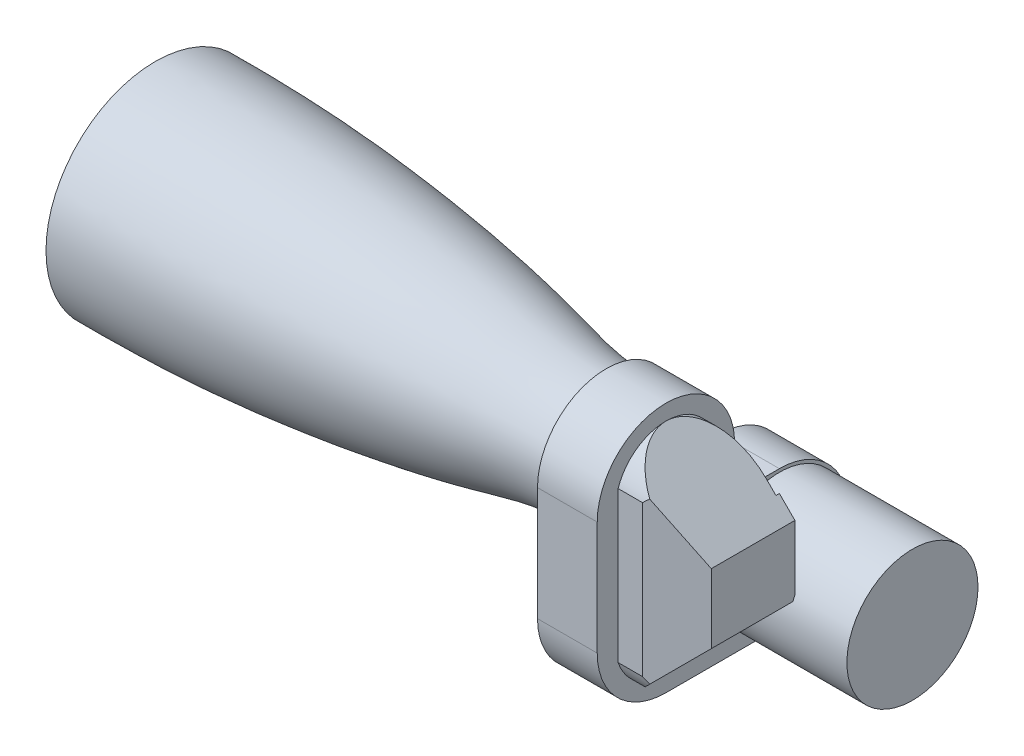
from build123d import *

# Parameters (mm, degrees)
BOSS_EXTRUDE1_DEPTH = 10
BOSS_EXTRUDE2_START = -3.5
BOSS_EXTRUDE2_DEPTH = 17
BOSS_EXTRUDE3_START = -5
BOSS_EXTRUDE3_DEPTH = 10
SKETCH6_OUTSIDE_W   = 74.788
SKETCH6_OUTSIDE_H   = 74.788
CUT_EXTRUDE1_DEPTH  = 10
SKETCH5_R           = 10.975
BOSS_EXTRUDE4_DEPTH = 22.28
CHAMFER2_SIZE       = 8.5
CHAMFER2_SIZE_2     = 3


with BuildPart() as part:
    # Sketch1 → Revolve1 (revolve)
    with BuildSketch(Plane(origin=(0, 0, 0), x_dir=(1, 0, 0), z_dir=(0, 1, 0))):
        with BuildLine():
            Line((75.5, 0), (75.5, 10))
            add(Edge.make_bspline(
                [(0, 18.3), (9.740701491, 18.3), (26.990075189, 17.742872667), (54.88230213, 14.080751962), (69.777131961, 10), (75.5, 10)],
                knots=[0, 0, 0, 0, 0.31632777, 0.808812889, 1, 1, 1, 1], degree=3))
            Line((0, 18.3), (0, 0))
            Line((0, 0), (75.5, 0))
        make_face()
    revolve(axis=Axis((0, 0, 0), (1, 0, 0)))

    # Sketch2 → Boss-Extrude1 (add)
    with BuildSketch(Plane(origin=(75.5, 0, 0), x_dir=(0, 0, -1), z_dir=(1, 0, 0))):
        with BuildLine():
            Line((-11.5, 0), (-11.5, -19))
            ThreePointArc((-11.5, -19), (-8.131727984, -27.131727984), (0, -30.5))
            Line((0, -30.5), (19, -30.5))
            ThreePointArc((19, -30.5), (30.5, -19), (19, -7.5))
            Line((19, -7.5), (11.5, -7.5))
            Line((11.5, -7.5), (11.5, 0))
            ThreePointArc((11.5, 0), (0, 11.5), (-11.5, 0))
        make_face()
    extrude(amount=BOSS_EXTRUDE1_DEPTH)

    # Sketch3 → Boss-Extrude2 (add)
    with BuildSketch(Plane.XY.offset(11.5).offset(BOSS_EXTRUDE2_START)):
        Polygon((85.5, -27.9), (98.1, -15.3), (98.1, -3.7), (85.5, 8.9), align=None)
    extrude(amount=-BOSS_EXTRUDE2_DEPTH)

    # Sketch4 → Boss-Extrude3 (add)
    with BuildSketch(Plane(origin=(0, -30.5, 0), x_dir=(-1, 0, 0), z_dir=(0, -1, 0)).offset(BOSS_EXTRUDE3_START)):
        Polygon((-75.5, -6.49101914), (-61.854263107, 7.154717753), (-61.854263107, 15.856079818), (-75.5, 29.50181671), align=None)
    extrude(amount=-BOSS_EXTRUDE3_DEPTH)

    # Sketch6 outside → Cut-Extrude1 (cut)
    with BuildSketch(Plane(origin=(85.5, 0, 0), x_dir=(0, 0, -1), z_dir=(1, 0, 0))):
        with Locations((6.1, -6.1)):
            Rectangle(SKETCH6_OUTSIDE_W, SKETCH6_OUTSIDE_H)
        with BuildLine():
            Line((8.423507913, 0.476492087), (8.423507913, -19.476492087))
            ThreePointArc((8.423507913, -19.476492087), (0, -27.9), (-8.423507913, -19.476492087))
            Line((-8.423507913, -19.476492087), (-8.423507913, 0.476492087))
            ThreePointArc((-8.423507913, 0.476492087), (0, 8.9), (8.423507913, 0.476492087))
        make_face(mode=Mode.SUBTRACT)
    extrude(amount=CUT_EXTRUDE1_DEPTH, mode=Mode.SUBTRACT)

    # Sketch5 → Boss-Extrude4 (add)
    with BuildSketch(Plane(origin=(85.5, 0, 0), x_dir=(0, 0, -1), z_dir=(1, 0, 0))):
        with Locations(Location((19, -19, 0), (0, 0, 191.531863493))):
            Circle(SKETCH5_R)
    extrude(amount=BOSS_EXTRUDE4_DEPTH)

    # Chamfer2
    # the kernel refuses this chamfer: 8.5, 3 mm, written as the material it takes off along each edge
    with BuildSketch(Plane(origin=(98.1, -37.353356339, 8), x_dir=(-0.9999177197745295, 0, 0.012827847867252683), z_dir=(0, 1, 0))) as chamfer2_piece_1:
        Polygon((CHAMFER2_SIZE * 0.999917719775, -CHAMFER2_SIZE * 0.0128278478673), (-CHAMFER2_SIZE_2 * 0.0128278478673, -CHAMFER2_SIZE_2 * 0.999917719775), (0, 0), align=None)
    extrude(amount=55.706712677, mode=Mode.SUBTRACT)


solid = part.part
